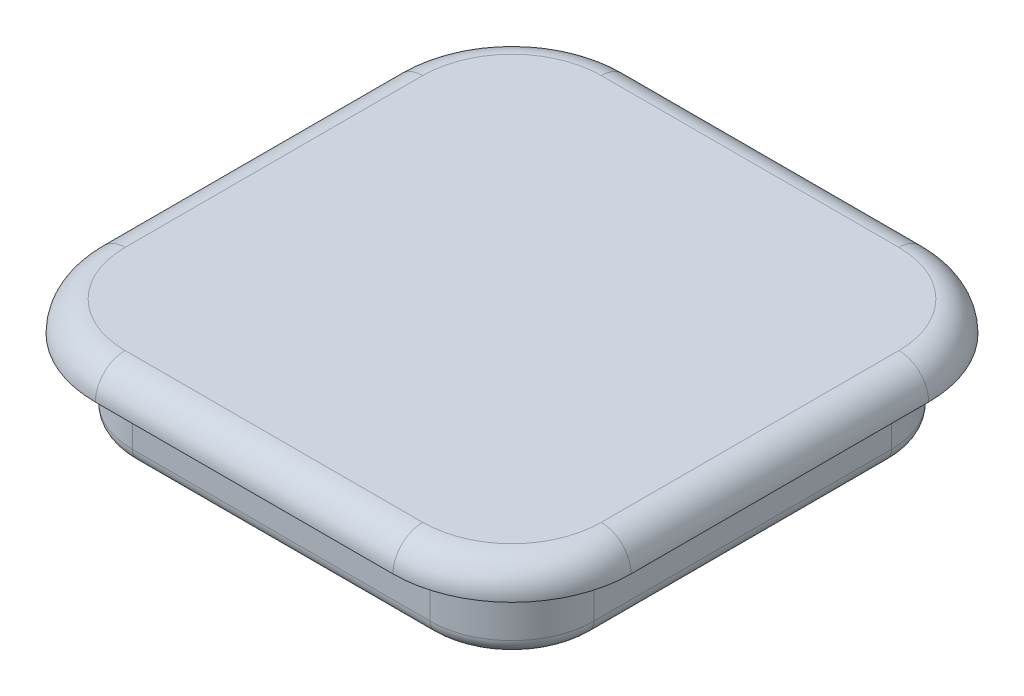
from build123d import *

# Parameters (mm, degrees)
SKETCH1_W           = 18
SKETCH1_H           = 18
BOSS_EXTRUDE1_DEPTH = 1
FILLET1_R           = 4
SKETCH2_R           = 4.85
SKETCH2_R_2         = 3.85
BOSS_EXTRUDE2_DEPTH = 2.5
FILLET2_R           = 1
FILLET3_R           = 0.5


with BuildPart() as part:
    # Sketch1 → Boss-Extrude1 (new body)
    with BuildSketch(Plane(origin=(0, 0, 0), x_dir=(1, 0, 0), z_dir=(0, 1, 0))):
        with Locations((9, -9)):
            Rectangle(SKETCH1_W, SKETCH1_H)
    extrude(amount=BOSS_EXTRUDE1_DEPTH)

    # Fillet1
    fillet1_edges = [part.edges().sort_by_distance(p)[0] for p in [
        (0, 0.5, 0),
        (18, 0.5, 0),
        (18, 0.5, 18),
        (0, 0.5, 18),
    ]]
    fillet(fillet1_edges, radius=FILLET1_R)

    # Sketch2 → Boss-Extrude2 (add)
    # profile 1 of 2: a face of its own
    with BuildSketch(Plane.XZ):
        with BuildLine():
            Line((1.25, 14), (1.25, 4))
            ThreePointArc((1.25, 4), (2.055456352, 2.055456352), (4, 1.25))
            Line((4, 1.25), (14, 1.25))
            ThreePointArc((14, 1.25), (15.944543648, 2.055456352), (16.75, 4))
            Line((16.75, 4), (16.75, 14))
            ThreePointArc((16.75, 14), (15.944543648, 15.944543648), (14, 16.75))
            Line((14, 16.75), (4, 16.75))
            ThreePointArc((4, 16.75), (2.055456352, 15.944543648), (1.25, 14))
        make_face()
        with BuildLine():
            Line((2.25, 14), (2.25, 4))
            ThreePointArc((2.25, 4), (2.762563133, 2.762563133), (4, 2.25))
            Line((4, 2.25), (14, 2.25))
            ThreePointArc((14, 2.25), (15.237436867, 2.762563133), (15.75, 4))
            Line((15.75, 4), (15.75, 14))
            ThreePointArc((15.75, 14), (15.237436867, 15.237436867), (14, 15.75))
            Line((14, 15.75), (4, 15.75))
            ThreePointArc((4, 15.75), (2.762563133, 15.237436867), (2.25, 14))
        make_face(mode=Mode.SUBTRACT)
    # profile 2 of 2: a face of its own
    with BuildSketch(Plane.XZ):
        with Locations(Location((9, 9, 0), (0, 0, 90))):
            Circle(SKETCH2_R)
        with Locations(Location((9, 9, 0), (0, 0, 270))):
            Circle(SKETCH2_R_2, mode=Mode.SUBTRACT)
    extrude(amount=BOSS_EXTRUDE2_DEPTH)

    # Fillet2
    fillet2_edges = [part.edges().sort_by_distance(p)[0] for p in [
        (16.828427125, 1, 1.171572875),
        (18, 1, 9),
        (16.828427125, 1, 16.828427125),
        (9, 1, 18),
        (1.171572875, 1, 16.828427125),
        (0, 1, 9),
        (1.171572875, 1, 1.171572875),
        (9, 1, 0),
    ]]
    fillet(fillet2_edges, radius=FILLET2_R - 0.0001)  # a hair under: the kernel refuses the full size

    # Fillet3
    fillet3_edges = [part.edges().sort_by_distance(p)[0] for p in [
        (2.762563133, -2.5, 15.237436867),
        (9, -2.5, 15.75),
        (15.237436867, -2.5, 15.237436867),
        (15.75, -2.5, 9),
        (15.237436867, -2.5, 2.762563133),
        (9, -2.5, 2.25),
        (2.762563133, -2.5, 2.762563133),
        (2.25, -2.5, 9),
        (9, -2.5, 16.75),
        (2.055456352, -2.5, 15.944543648),
        (1.25, -2.5, 9),
        (2.055456352, -2.5, 2.055456352),
        (9, -2.5, 1.25),
        (15.944543648, -2.5, 2.055456352),
        (16.75, -2.5, 9),
        (15.944543648, -2.5, 15.944543648),
        (9, -2.5, 12.85),
        (9, -2.5, 4.15),
    ]]
    fillet(fillet3_edges, radius=FILLET3_R - 0.0001)  # a hair under: the kernel refuses the full size


solid = part.part
